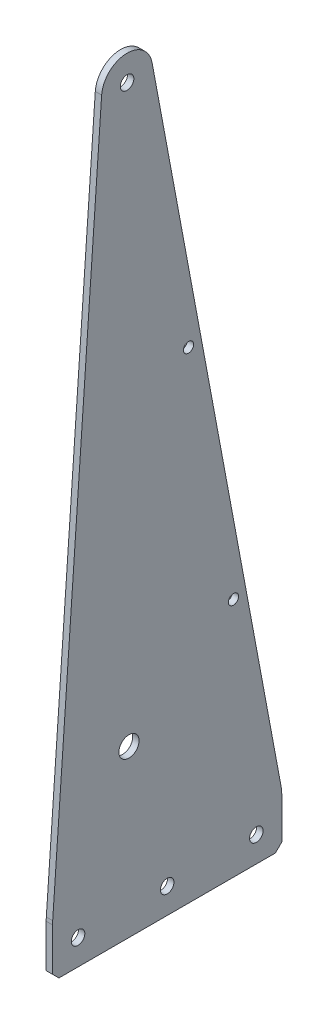
from build123d import *

# Parameters (mm, degrees)
SKETCH2_R           = 5.0419
SKETCH2_R_2         = 3.3782
BOSS_EXTRUDE2_DEPTH = 3.175
SKETCH3_R           = 3.3782
SKETCH3_R_2         = 2.54
CUT_EXTRUDE1_DEPTH  = 408.087553815
CHAMFER1_SIZE       = 3.175
FILLET1_R           = 25.4


with BuildPart() as part:
    # Sketch2 → Boss-Extrude2 (new body)
    with BuildSketch(Plane(origin=(0, 0, 0), x_dir=(0, 0, -1), z_dir=(1, 0, 0))):
        with BuildLine():
            Line((25.4, 0), (25.4, 25.4))
            Line((25.4, 25.4), (49.872202827, 370.551588468))
            ThreePointArc((49.872202827, 370.551588468), (61.818783569, 382.33286047), (75.02488963, 371.98308153))
            Line((75.02488963, 371.98308153), (139.7, 25.4))
            Line((139.7, 25.4), (139.7, 0))
            Line((139.7, 0), (25.4, 0))
        make_face()
        with Locations((63.5, 82.55)):
            Circle(SKETCH2_R, mode=Mode.SUBTRACT)
        with Locations((62.540399951, 369.653378233)):
            Circle(SKETCH2_R_2, mode=Mode.SUBTRACT)
    extrude(amount=BOSS_EXTRUDE2_DEPTH)

    # Sketch3 → Cut-Extrude1 (cut, through all)
    with BuildSketch(Plane(origin=(3.175, 0, 0), x_dir=(0, 0, -1), z_dir=(1, 0, 0))):
        with Locations((38.1, 12.7)):
            Circle(SKETCH3_R)
        with Locations((82.55, 12.7)):
            Circle(SKETCH3_R)
        with Locations((127, 12.7)):
            Circle(SKETCH3_R)
        with Locations((93.193559072, 240.004229778)):
            Circle(SKETCH3_R_2)
        with Locations((115.586891115, 120.002114889)):
            Circle(SKETCH3_R_2)
    extrude(amount=-CUT_EXTRUDE1_DEPTH, mode=Mode.SUBTRACT)

    # Chamfer1
    chamfer1_edges = [part.edges().sort_by_distance(p)[0] for p in [
        (1.5875, 0, -25.4),
        (1.5875, 0, -139.7),
    ]]
    chamfer(chamfer1_edges, length=CHAMFER1_SIZE)

    # Fillet1
    # the kernel refuses this fillet: 25.4 mm, written as the material it takes off along each edge
    with BuildSketch(Plane(origin=(-2.248340694, 25.4, -25.4), x_dir=(0, -1, 0), z_dir=(1, 0, 0))) as fillet1_piece_1:
        with BuildLine():
            CenterArc((FILLET1_R * 0.0354069400697, FILLET1_R), FILLET1_R, 265.944357758, 4.055642242)
            Line((-FILLET1_R * 0.0353182753041, FILLET1_R * 0.00250416346216), (0, 0))
            Line((0, 0), (FILLET1_R * 0.0354069400697, 0))
        make_face()
    extrude(amount=7.671681389, mode=Mode.SUBTRACT)
    with BuildSketch(Plane(origin=(-5.874097958, 25.4, -139.7), x_dir=(0, 0.9830306833875174, 0.1834412045279636), z_dir=(1, 0, 0))) as fillet1_piece_2:
        with BuildLine():
            CenterArc((FILLET1_R * 0.0925054796503, FILLET1_R), FILLET1_R, 259.429735221, 10.570264779)
            Line((-FILLET1_R * 0.0909357248777, FILLET1_R * 0.0169693166125), (0, 0))
            Line((0, 0), (FILLET1_R * 0.0925054796503, 0))
        make_face()
    extrude(amount=14.923195916, mode=Mode.SUBTRACT)


solid = part.part
